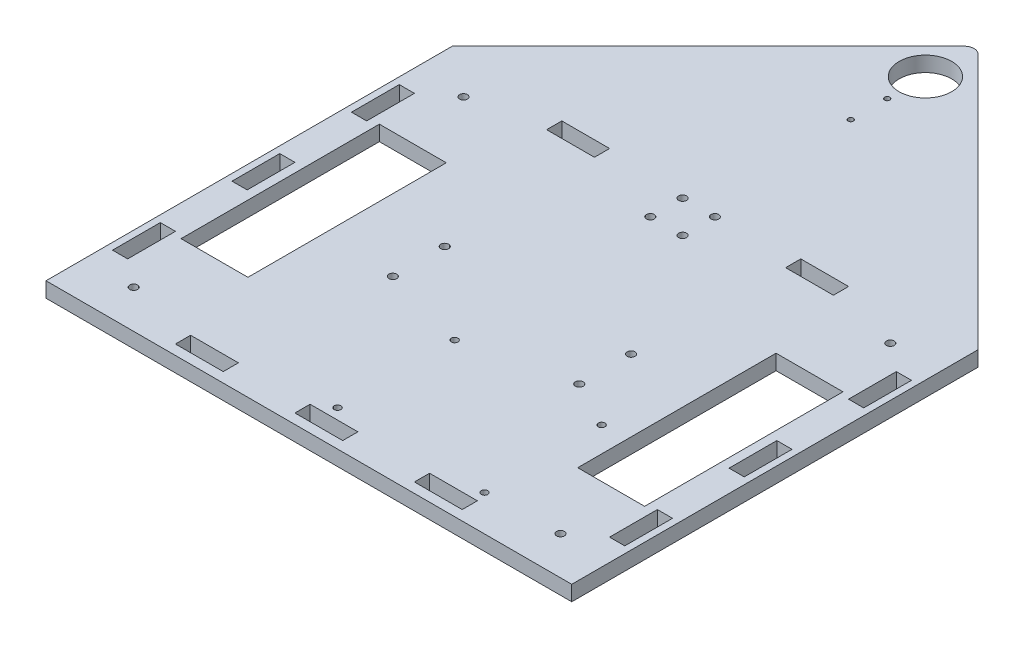
from build123d import *

# Parameters (mm, degrees)
SKETCH1_R           = 1.65
SKETCH1_R_2         = 1.1
SKETCH1_R_3         = 1.4
SKETCH1_R_4         = 11
SKETCH1_W           = 28
SKETCH1_H           = 83
SKETCH1_W_2         = 6.35
SKETCH1_H_2         = 20
SKETCH1_W_3         = 20
SKETCH1_H_3         = 6.35
BOSS_EXTRUDE1_DEPTH = 6.35


with BuildPart() as part:
    # Sketch1 → Boss-Extrude1 (new body)
    with BuildSketch(Plane(origin=(0, 0, 0), x_dir=(1, 0, 0), z_dir=(0, 1, 0))):
        with BuildLine():
            Line((-110, 85), (-2.828427125, 192.171572875))
            ThreePointArc((-2.828427125, 192.171572875), (0, 193.343145751), (2.828427125, 192.171572875))
            Line((2.828427125, 192.171572875), (110, 85))
            Line((110, 85), (110, -85))
            Line((110, -85), (-110, -85))
            Line((-110, -85), (-110, 85))
        make_face()
        with Locations((-39, 10.85)):
            Circle(SKETCH1_R, mode=Mode.SUBTRACT)
        with Locations((-39, -10.85)):
            Circle(SKETCH1_R, mode=Mode.SUBTRACT)
        with Locations((-89.294117647, -69)):
            Circle(SKETCH1_R, mode=Mode.SUBTRACT)
        with Locations((89.294117647, -69)):
            Circle(SKETCH1_R, mode=Mode.SUBTRACT)
        with Locations((-89.294117647, 69)):
            Circle(SKETCH1_R, mode=Mode.SUBTRACT)
        with Locations((89.294117647, 69)):
            Circle(SKETCH1_R, mode=Mode.SUBTRACT)
        with Locations((39, -10.85)):
            Circle(SKETCH1_R, mode=Mode.SUBTRACT)
        with Locations((39, 10.85)):
            Circle(SKETCH1_R, mode=Mode.SUBTRACT)
        with Locations((0, 157)):
            Circle(SKETCH1_R_2, mode=Mode.SUBTRACT)
        with Locations((0, 141.75)):
            Circle(SKETCH1_R_2, mode=Mode.SUBTRACT)
        with Locations((-3, -21)):
            Circle(SKETCH1_R_3, mode=Mode.SUBTRACT)
        with Locations((-3, -70)):
            Circle(SKETCH1_R_3, mode=Mode.SUBTRACT)
        with Locations((58.5, -70)):
            Circle(SKETCH1_R_3, mode=Mode.SUBTRACT)
        with Locations((58.5, -21)):
            Circle(SKETCH1_R_3, mode=Mode.SUBTRACT)
        with Locations((-6.75, 78.125)):
            Circle(SKETCH1_R, mode=Mode.SUBTRACT)
        with Locations((6.75, 78.125)):
            Circle(SKETCH1_R, mode=Mode.SUBTRACT)
        with Locations((6.75, 64.625)):
            Circle(SKETCH1_R, mode=Mode.SUBTRACT)
        with Locations((-6.75, 64.625)):
            Circle(SKETCH1_R, mode=Mode.SUBTRACT)
        with Locations((0, 173)):
            Circle(SKETCH1_R_4, mode=Mode.SUBTRACT)
        with Locations((-83, 0)):
            Rectangle(SKETCH1_W, SKETCH1_H, mode=Mode.SUBTRACT)
        with Locations((-104, 50)):
            Rectangle(SKETCH1_W_2, SKETCH1_H_2, mode=Mode.SUBTRACT)
        with Locations((-104, 0)):
            Rectangle(SKETCH1_W_2, SKETCH1_H_2, mode=Mode.SUBTRACT)
        with Locations((-104, -50)):
            Rectangle(SKETCH1_W_2, SKETCH1_H_2, mode=Mode.SUBTRACT)
        with Locations((50, -77.667136592)):
            Rectangle(SKETCH1_W_3, SKETCH1_H_3, mode=Mode.SUBTRACT)
        with Locations((0, -77.667136592)):
            Rectangle(SKETCH1_W_3, SKETCH1_H_3, mode=Mode.SUBTRACT)
        with Locations((-50, -77.667136592)):
            Rectangle(SKETCH1_W_3, SKETCH1_H_3, mode=Mode.SUBTRACT)
        with Locations((104, -50)):
            Rectangle(SKETCH1_W_2, SKETCH1_H_2, mode=Mode.SUBTRACT)
        with Locations((104, 50)):
            Rectangle(SKETCH1_W_2, SKETCH1_H_2, mode=Mode.SUBTRACT)
        with Locations((104, 0)):
            Rectangle(SKETCH1_W_2, SKETCH1_H_2, mode=Mode.SUBTRACT)
        with Locations((-50, 77.667136592)):
            Rectangle(SKETCH1_W_3, SKETCH1_H_3, mode=Mode.SUBTRACT)
        with Locations((50, 77.667136592)):
            Rectangle(SKETCH1_W_3, SKETCH1_H_3, mode=Mode.SUBTRACT)
        with Locations((83, 0)):
            Rectangle(SKETCH1_W, SKETCH1_H, mode=Mode.SUBTRACT)
    extrude(amount=BOSS_EXTRUDE1_DEPTH)


solid = part.part
